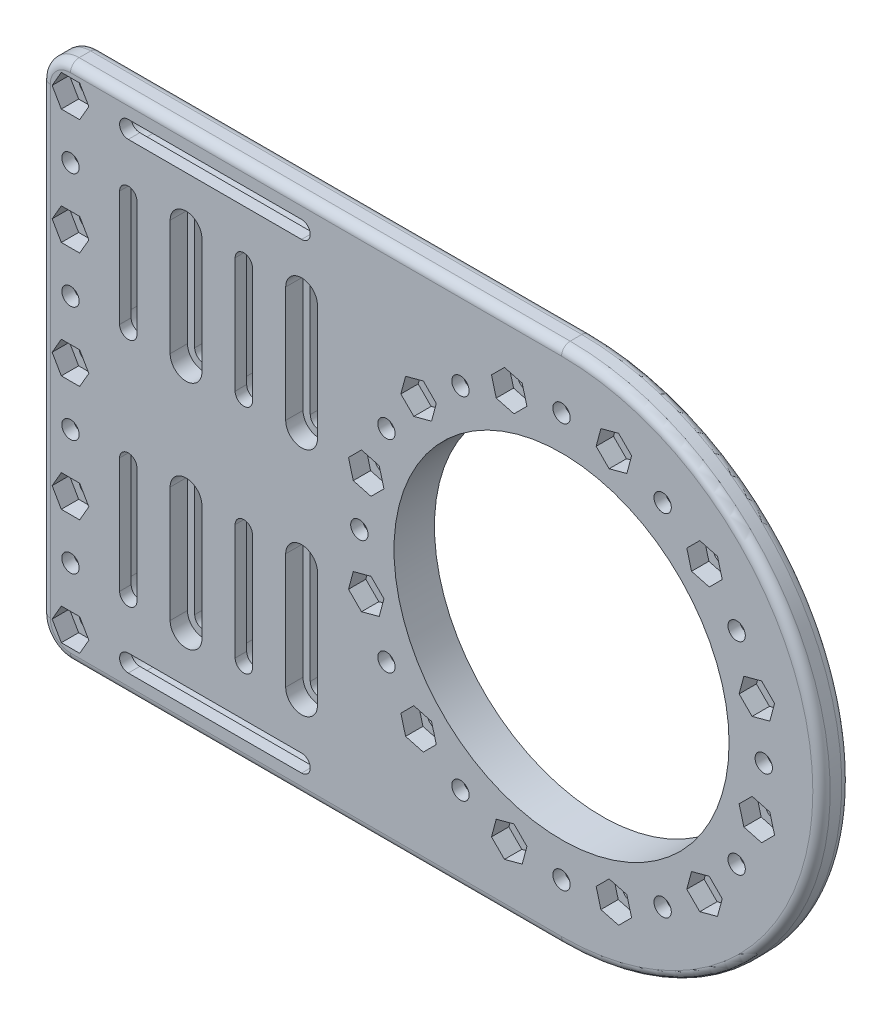
from build123d import *

# Parameters (mm, degrees)
EXTRUDE_1_DEPTH             = 5
SKETCH_2_R                  = 29
CUT_EXTRUDE_1_DEPTH         = 101.747208398
SKETCH_3_R                  = 45
SKETCH_3_R_2                = 29
EXTRUDE_2_DEPTH             = 2
SKETCH_9_R                  = 45
SKETCH_9_R_2                = 31
CUT_EXTRUDE_10_DEPTH        = 2
SKETCH_5_R                  = 1.5
CUT_EXTRUDE_2_DEPTH         = 101.747208398
CUT_EXTRUDE_3_DEPTH         = 3
SKETCH_10_R                 = 1.5
CUT_EXTRUDE_11_DEPTH        = 101.866248071
CUT_EXTRUDE_12_DEPTH        = 3
PATTERN_CIRCULAR_1_COUNT    = 12
CUT_EXTRUDE_7_DEPTH         = 101.866248071
CUT_EXTRUDE_9_DEPTH         = 3
SKETCH_12_R                 = 1.5
CUT_EXTRUDE_13_DEPTH        = 101.866248071
CUT_EXTRUDE_14_DEPTH        = 3
PATTERN_LINEAR_5_COUNT      = 5
PATTERN_LINEAR_5_PITCH      = 10
PATTERN_LINEAR_5_COL_COUNT  = 5
PATTERN_LINEAR_5_COL_PITCH  = 10
PATTERN_LINEAR_1_COUNT      = 3
PATTERN_LINEAR_1_PITCH      = 20
PATTERN_LINEAR_1_COL_COUNT  = 3
PATTERN_LINEAR_1_COL_PITCH  = 20
CUT_EXTRUDE_18_DEPTH        = 3
PATTERN_LINEAR_6_COUNT      = 3
PATTERN_LINEAR_6_PITCH      = 20
PATTERN_LINEAR_6_COUNT_DIR2 = 3
PATTERN_LINEAR_6_PITCH_DIR2 = 20
CUT_EXTRUDE_15_DEPTH        = 101.866248071
CUT_EXTRUDE_16_DEPTH        = 3
PATTERN_LINEAR_2_COUNT      = 4
PATTERN_LINEAR_2_PITCH      = 10
PATTERN_LINEAR_3_COUNT      = 2
PATTERN_LINEAR_3_PITCH      = 20
CUT_EXTRUDE_17_DEPTH        = 3
PATTERN_LINEAR_4_COUNT      = 2
PATTERN_LINEAR_4_PITCH      = 20
FILLET_4_R                  = 1.5
FILLET_5_R                  = 5


with BuildPart() as part:
    # 草图1 → 凸台-拉伸1 (new body)
    with BuildSketch(Plane.XY):
        with BuildLine():
            Line((-45, -45), (45, -45))
            ThreePointArc((45, -45), (90, 0), (45, 45))
            Line((45, 45), (-45, 45))
            Line((-45, 45), (-45, -45))
        make_face()
    extrude(amount=EXTRUDE_1_DEPTH)

    # 草图2 → 切除-拉伸1 (cut, through all)
    with BuildSketch(Plane.XY.offset(5)):
        with Locations((45, 0)):
            Circle(SKETCH_2_R)
    cut_extrude_1 = extrude(amount=-CUT_EXTRUDE_1_DEPTH, mode=Mode.SUBTRACT)

    # 草图3 → 凸台-拉伸2 (add)
    with BuildSketch(Plane.XY):
        with Locations(Location((45, 0, 0), (0, 0, 270))):
            Circle(SKETCH_3_R)
        with Locations((45, 0)):
            Circle(SKETCH_3_R_2, mode=Mode.SUBTRACT)
    extrude(amount=-EXTRUDE_2_DEPTH)

    # 草图9 → 切除-拉伸10 (cut)
    with BuildSketch(Plane(origin=(0, 0, -2), x_dir=(-1, 0, 0), z_dir=(0, 0, -1))):
        with Locations((-45, 0)):
            Circle(SKETCH_9_R)
        with Locations((-45, 0)):
            Circle(SKETCH_9_R_2, mode=Mode.SUBTRACT)
    extrude(amount=-CUT_EXTRUDE_10_DEPTH, mode=Mode.SUBTRACT)

    # 草图5 → 切除-拉伸2 (cut, through all)
    with BuildSketch(Plane(origin=(0, 0, 0), x_dir=(-1, 0, 0), z_dir=(0, 0, -1))):
        with Locations((-45, 35)):
            Circle(SKETCH_5_R)
    cut_extrude_2 = extrude(amount=-CUT_EXTRUDE_2_DEPTH, mode=Mode.SUBTRACT)

    # 草图6 → 切除-拉伸3 (cut)
    with BuildSketch(Plane(origin=(0, 0, 0), x_dir=(-1, 0, 0), z_dir=(0, 0, -1))):
        Polygon((-45, 31.824573519), (-42.25, 33.41228676), (-42.25, 36.58771324), (-45, 38.175426481), (-47.75, 36.58771324), (-47.75, 33.41228676), align=None)
    cut_extrude_3 = extrude(amount=-CUT_EXTRUDE_3_DEPTH, mode=Mode.SUBTRACT)

    # 草图10 → 切除-拉伸11 (cut, through all)
    with BuildSketch(Plane(origin=(0, 0, -2), x_dir=(-1, 0, 0), z_dir=(0, 0, -1))):
        with Locations((-35.941333421, 33.80740392)):
            Circle(SKETCH_10_R)
    cut_extrude_11 = extrude(amount=-CUT_EXTRUDE_11_DEPTH, mode=Mode.SUBTRACT)

    # 草图11 → 切除-拉伸12 (cut)
    with BuildSketch(Plane.XY.offset(5)):
        Polygon((36.763194271, 30.740177473), (39.008559868, 32.985543071), (38.186699019, 36.052769518), (35.119472572, 36.874630367), (32.874106974, 34.62926477), (33.695967824, 31.562038323), align=None)
    cut_extrude_12 = extrude(amount=-CUT_EXTRUDE_12_DEPTH, mode=Mode.SUBTRACT)

    # 阵列(圆周)1: 切除-拉伸1, 切除-拉伸2, 切除-拉伸3, 切除-拉伸11, 切除-拉伸12 ×12 about axis
    pattern_circular_1_axis = Axis((45, 0, 0), (0, 0, 1))
    add([cut_extrude_1.rotate(pattern_circular_1_axis, i * 360 / PATTERN_CIRCULAR_1_COUNT) for i in range(1, PATTERN_CIRCULAR_1_COUNT)], mode=Mode.SUBTRACT)
    add([cut_extrude_2.rotate(pattern_circular_1_axis, i * 360 / PATTERN_CIRCULAR_1_COUNT) for i in range(1, PATTERN_CIRCULAR_1_COUNT)], mode=Mode.SUBTRACT)
    add([cut_extrude_3.rotate(pattern_circular_1_axis, i * 360 / PATTERN_CIRCULAR_1_COUNT) for i in range(1, PATTERN_CIRCULAR_1_COUNT)], mode=Mode.SUBTRACT)
    add([cut_extrude_11.rotate(pattern_circular_1_axis, i * 360 / PATTERN_CIRCULAR_1_COUNT) for i in range(1, PATTERN_CIRCULAR_1_COUNT)], mode=Mode.SUBTRACT)
    add([cut_extrude_12.rotate(pattern_circular_1_axis, i * 360 / PATTERN_CIRCULAR_1_COUNT) for i in range(1, PATTERN_CIRCULAR_1_COUNT)], mode=Mode.SUBTRACT)

    # 草图7 → 切除-拉伸7 (cut, through all)
    with BuildSketch(Plane.XY.offset(5)):
        with BuildLine():
            Line((-30, 41.5), (0, 41.5))
            ThreePointArc((0, 41.5), (1.5, 40), (0, 38.5))
            Line((0, 38.5), (-30, 38.5))
            ThreePointArc((-30, 38.5), (-31.5, 40), (-30, 41.5))
        make_face()
        with BuildLine():
            Line((-30, -41.5), (0, -41.5))
            ThreePointArc((0, -41.5), (1.5, -40), (0, -38.5))
            Line((0, -38.5), (-30, -38.5))
            ThreePointArc((-30, -38.5), (-31.5, -40), (-30, -41.5))
        make_face()
    extrude(amount=-CUT_EXTRUDE_7_DEPTH, mode=Mode.SUBTRACT)

    # 草图8 → 切除-拉伸9 (cut)
    with BuildSketch(Plane.XY):
        with BuildLine():
            Line((-30, 42.75), (0, 42.75))
            ThreePointArc((0, 42.75), (2.75, 40), (0, 37.25))
            Line((0, 37.25), (-30, 37.25))
            ThreePointArc((-30, 37.25), (-32.75, 40), (-30, 42.75))
        make_face()
        with BuildLine():
            Line((-30, -37.25), (0, -37.25))
            ThreePointArc((0, -37.25), (2.75, -40), (0, -42.75))
            Line((0, -42.75), (-30, -42.75))
            ThreePointArc((-30, -42.75), (-32.75, -40), (-30, -37.25))
        make_face()
    extrude(amount=CUT_EXTRUDE_9_DEPTH, mode=Mode.SUBTRACT)

    # 草图12 → 切除-拉伸13 (cut, through all)
    with BuildSketch(Plane.XY.offset(5)):
        with Locations((-40, 0)):
            Circle(SKETCH_12_R)
    cut_extrude_13 = extrude(amount=-CUT_EXTRUDE_13_DEPTH, mode=Mode.SUBTRACT)

    # 草图13 → 切除-拉伸14 (cut)
    with BuildSketch(Plane.XY.offset(5)):
        Polygon((-36.824573519, 0), (-38.41228676, 2.75), (-41.58771324, 2.75), (-43.175426481, 0), (-41.58771324, -2.75), (-38.41228676, -2.75), align=None)
    cut_extrude_14 = extrude(amount=-CUT_EXTRUDE_14_DEPTH, mode=Mode.SUBTRACT)

    # 阵列(线性)5: 切除-拉伸13 ×5
    with Locations(*[(0, -i * PATTERN_LINEAR_5_PITCH, 0) for i in range(1, PATTERN_LINEAR_5_COUNT)]):
        add(cut_extrude_13, mode=Mode.SUBTRACT)

    # 阵列(线性)5 col: 切除-拉伸13 ×5
    with Locations(*[(0, i * PATTERN_LINEAR_5_COL_PITCH, 0) for i in range(1, PATTERN_LINEAR_5_COL_COUNT)]):
        add(cut_extrude_13, mode=Mode.SUBTRACT)

    # 阵列(线性)1: 切除-拉伸14 ×3
    with Locations(*[(0, -i * PATTERN_LINEAR_1_PITCH, 0) for i in range(1, PATTERN_LINEAR_1_COUNT)]):
        add(cut_extrude_14, mode=Mode.SUBTRACT)

    # 阵列(线性)1 col: 切除-拉伸14 ×3
    with Locations(*[(0, i * PATTERN_LINEAR_1_COL_PITCH, 0) for i in range(1, PATTERN_LINEAR_1_COL_COUNT)]):
        add(cut_extrude_14, mode=Mode.SUBTRACT)

    # 草图17 → 切除-拉伸18 (cut)
    with BuildSketch(Plane(origin=(0, 0, 0), x_dir=(-1, 0, 0), z_dir=(0, 0, -1))):
        Polygon((43.175426481, 10), (41.58771324, 12.75), (38.41228676, 12.75), (36.824573519, 10), (38.41228676, 7.25), (41.58771324, 7.25), align=None)
    cut_extrude_18 = extrude(amount=-CUT_EXTRUDE_18_DEPTH, mode=Mode.SUBTRACT)

    # 阵列(线性)6: Cut-Extrude 18 3 × 3
    with Locations(*[Vector(0, -1, 0) * (i * PATTERN_LINEAR_6_PITCH) + Vector(0, 1, 0) * (j * PATTERN_LINEAR_6_PITCH_DIR2) for i in range(PATTERN_LINEAR_6_COUNT) for j in range(PATTERN_LINEAR_6_COUNT_DIR2) if (i, j) != (0, 0)]):
        add(cut_extrude_18, mode=Mode.SUBTRACT)

    # 草图14 → 切除-拉伸15 (cut, through all)
    with BuildSketch(Plane.XY.offset(5)):
        with BuildLine():
            Line((1.5, 30), (1.5, 10))
            ThreePointArc((1.5, 10), (0, 8.5), (-1.5, 10))
            Line((-1.5, 10), (-1.5, 30))
            ThreePointArc((-1.5, 30), (0, 31.5), (1.5, 30))
        make_face()
        with BuildLine():
            Line((1.5, -30), (1.5, -10))
            ThreePointArc((1.5, -10), (0, -8.5), (-1.5, -10))
            Line((-1.5, -10), (-1.5, -30))
            ThreePointArc((-1.5, -30), (0, -31.5), (1.5, -30))
        make_face()
    cut_extrude_15 = extrude(amount=-CUT_EXTRUDE_15_DEPTH, mode=Mode.SUBTRACT)

    # 草图15 → 切除-拉伸16 (cut)
    with BuildSketch(Plane.XY.offset(5)):
        with BuildLine():
            Line((-2.75, 10), (-2.75, 30))
            ThreePointArc((-2.75, 30), (0, 32.75), (2.75, 30))
            Line((2.75, 30), (2.75, 10))
            ThreePointArc((2.75, 10), (0, 7.25), (-2.75, 10))
        make_face()
        with BuildLine():
            Line((2.75, -10), (2.75, -30))
            ThreePointArc((2.75, -30), (0, -32.75), (-2.75, -30))
            Line((-2.75, -30), (-2.75, -10))
            ThreePointArc((-2.75, -10), (0, -7.25), (2.75, -10))
        make_face()
    cut_extrude_16 = extrude(amount=-CUT_EXTRUDE_16_DEPTH, mode=Mode.SUBTRACT)

    # 阵列(线性)2: 切除-拉伸15 ×4
    with Locations(*[(-i * PATTERN_LINEAR_2_PITCH, 0, 0) for i in range(1, PATTERN_LINEAR_2_COUNT)]):
        add(cut_extrude_15, mode=Mode.SUBTRACT)

    # 阵列(线性)3: 切除-拉伸16 ×2
    with Locations(*[(-i * PATTERN_LINEAR_3_PITCH, 0, 0) for i in range(1, PATTERN_LINEAR_3_COUNT)]):
        add(cut_extrude_16, mode=Mode.SUBTRACT)

    # 草图16 → 切除-拉伸17 (cut)
    with BuildSketch(Plane(origin=(0, 0, 0), x_dir=(-1, 0, 0), z_dir=(0, 0, -1))):
        with BuildLine():
            Line((32.75, 30), (32.75, 10))
            ThreePointArc((32.75, 10), (30, 7.25), (27.25, 10))
            Line((27.25, 10), (27.25, 30))
            ThreePointArc((27.25, 30), (30, 32.75), (32.75, 30))
        make_face()
        with BuildLine():
            Line((32.75, -10), (32.75, -30))
            ThreePointArc((32.75, -30), (30, -32.75), (27.25, -30))
            Line((27.25, -30), (27.25, -10))
            ThreePointArc((27.25, -10), (30, -7.25), (32.75, -10))
        make_face()
    cut_extrude_17 = extrude(amount=-CUT_EXTRUDE_17_DEPTH, mode=Mode.SUBTRACT)

    # 阵列(线性)4: 切除-拉伸17 ×2
    with Locations(*[(i * PATTERN_LINEAR_4_PITCH, 0, 0) for i in range(1, PATTERN_LINEAR_4_COUNT)]):
        add(cut_extrude_17, mode=Mode.SUBTRACT)

    # 圆角4
    fillet_4_edges = [part.edges().sort_by_distance(p)[0] for p in [
        (-45, 0, 5),
        (0, -45, 5),
        (90, 0, 0),
        (90, 0, 5),
        (0, -45, 0),
        (-45, 0, 0),
        (0, 45, 0),
        (0, 45, 5),
    ]]
    fillet(fillet_4_edges, radius=FILLET_4_R)

    # 圆角5
    # the kernel refuses this fillet: 5 mm, written as the material it takes off along each edge
    with BuildSketch(Plane(origin=(-40, -40, 5), x_dir=(-1, 0, 0), z_dir=(0, 1, 0))) as fillet_5_piece_1:
        with BuildLine():
            CenterArc((3.5, -1.5), 1.5, 0, 90)
            Line((5, -1.5), (5, 0))
            Line((5, 0), (3.5, 0))
        make_face()
    revolve(axis=Axis((-40, -40, 5), (0, 0, 1)), revolution_arc=90, mode=Mode.SUBTRACT)
    with BuildSketch(Plane(origin=(-40, 40, 5), x_dir=(0, 1, 0), z_dir=(1, 0, 0))) as fillet_5_piece_2:
        with BuildLine():
            CenterArc((3.5, -1.5), 1.5, 0, 90)
            Line((5, -1.5), (5, 0))
            Line((5, 0), (3.5, 0))
        make_face()
    revolve(axis=Axis((-40, 40, 5), (0, 0, 1)), revolution_arc=90, mode=Mode.SUBTRACT)
    with BuildSketch(Plane(origin=(-40, 40, 0), x_dir=(-1, 0, 0), z_dir=(0, -1, 0))) as fillet_5_piece_3:
        with BuildLine():
            CenterArc((3.5, -1.5), 1.5, 0, 90)
            Line((5, -1.5), (5, 0))
            Line((5, 0), (3.5, 0))
        make_face()
    revolve(axis=Axis((-40, 40, 0), (0, 0, -1)), revolution_arc=90, mode=Mode.SUBTRACT)
    with BuildSketch(Plane(origin=(-40, -40, 0), x_dir=(0, -1, 0), z_dir=(1, 0, 0))) as fillet_5_piece_4:
        with BuildLine():
            CenterArc((3.5, -1.5), 1.5, 0, 90)
            Line((5, -1.5), (5, 0))
            Line((5, 0), (3.5, 0))
        make_face()
    revolve(axis=Axis((-40, -40, 0), (0, 0, -1)), revolution_arc=90, mode=Mode.SUBTRACT)
    with BuildSketch(Plane(origin=(-45, 45, 0), x_dir=(1, 0, 0), z_dir=(0, 0, 1)), Plane(origin=(-45, -45, 0), x_dir=(0, 1, 0), z_dir=(0, 0, 1))) as fillet_5_piece_5:
        with BuildLine():
            CenterArc((FILLET_5_R, -FILLET_5_R), FILLET_5_R, 90, 90)
            Line((0, -FILLET_5_R), (0, 0))
            Line((0, 0), (FILLET_5_R, 0))
        make_face()
    extrude(amount=5, mode=Mode.SUBTRACT)


solid = part.part
